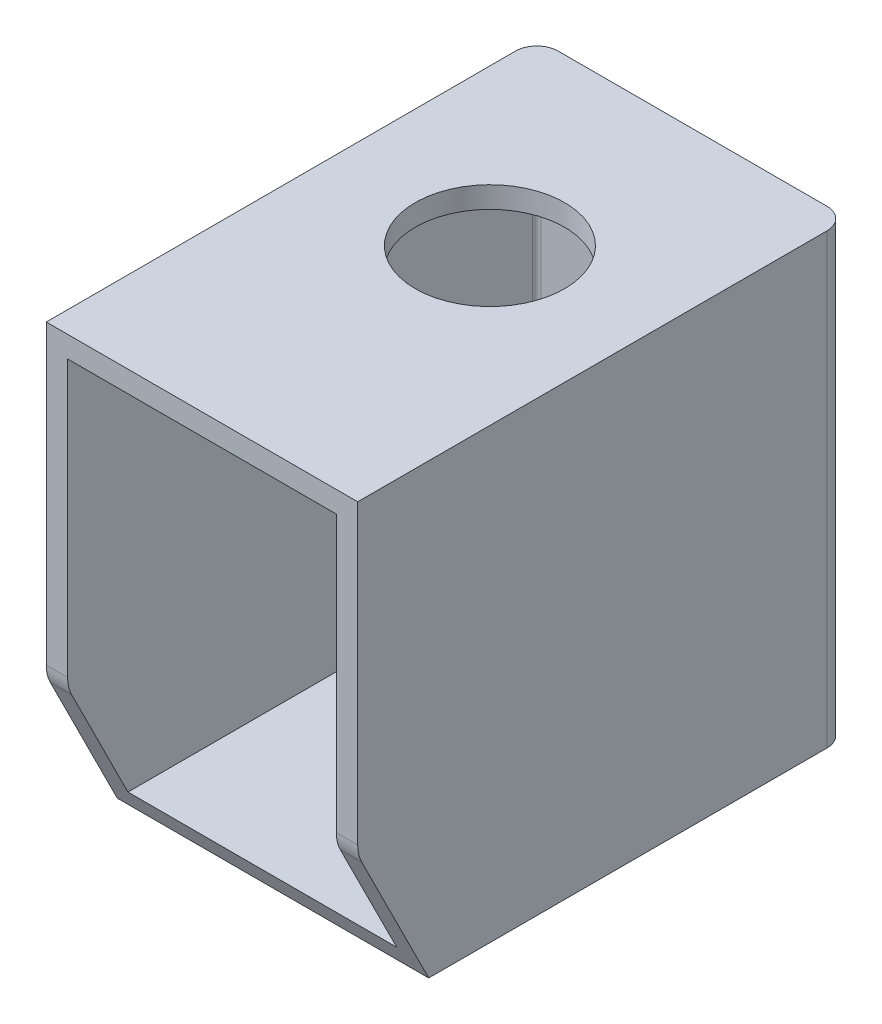
from build123d import *

# Parameters (mm, degrees)
MAINBODYS_W          = 14.6
MAINBODYS_H          = 23
MAIN_BODY_DEPTH      = 10.5
MB_FILLET_R          = 1
SHELL_START          = -6.3
SHELL_MB_OUTLINE_W   = 19
SHELL_MB_OUTLINE_H   = 22
SHELL_MB_DEPTH       = 12.6
TOP_BORE_REACH       = 27.031
TOPBORES_R           = 3.5
BOTTOMBORES_R        = 4.1
BOTTOM_BORE_DEPTH    = 25.197933796
ANGLEDCUT_DEPTH      = 18.19854645
ANGLEDCUT_DEPTH_BACK = 18.19854645
MB_INNER_FILLET_R    = 0.2
AC_F_R               = 1.76


# Read off the part's stored shape, not the designer's step: SHELL MB
with BuildPart() as part:
    # MainBodyS → MAIN BODY (new, symmetric)
    with BuildSketch(Plane(origin=(0, 0, 0), x_dir=(1, 0, 0), z_dir=(0, 1, 0))):
        Rectangle(MAINBODYS_W, MAINBODYS_H)
    extrude(amount=MAIN_BODY_DEPTH, both=True)

    # MB FILLET
    mb_fillet_edges = [part.edges().sort_by_distance(p)[0] for p in [
        (-7.3, 0, -11.5),
        (7.3, 0, -11.5),
    ]]
    fillet(mb_fillet_edges, radius=MB_FILLET_R)

    # SHELL MB outline → SHELL MB (cut)
    with BuildSketch(Plane.YZ.offset(SHELL_START)):
        with Locations((0, 0.5)):
            Rectangle(SHELL_MB_OUTLINE_W, SHELL_MB_OUTLINE_H)
    extrude(amount=SHELL_MB_DEPTH, mode=Mode.SUBTRACT)

    # TopBoreS → TOP BORE (cut, up to next)
    with BuildSketch(Plane(origin=(0, 10.5, 0), x_dir=(1, 0, 0), z_dir=(0, 1, 0)), mode=Mode.PRIVATE) as top_bore_sk1:
        with Locations(Location((0, 2, 0), (0, 0, 270))):
            Circle(TOPBORES_R)
    top_bore_tool1 = extrude(top_bore_sk1.sketch, amount=-TOP_BORE_REACH, mode=Mode.PRIVATE) & part.part
    add(top_bore_tool1.solids().sort_by_distance((0, 10.5, -2))[0], mode=Mode.SUBTRACT)

    # BottomBoreS → BOTTOM BORE (cut, through all)
    with BuildSketch(Plane(origin=(0, -9.5, 0), x_dir=(1, 0, 0), z_dir=(0, 1, 0))):
        with Locations(Location((0, 2, 0), (0, 0, 270))):
            Circle(BOTTOMBORES_R)
    extrude(amount=-BOTTOM_BORE_DEPTH, mode=Mode.SUBTRACT)

    # AngledCutS → AngledCut (cut, two sides: drawn at the far end of the back side and taken through both)
    with BuildSketch(Plane(origin=(0, 0, 0), x_dir=(0, 0, -1), z_dir=(1, 0, 0)).offset(-ANGLEDCUT_DEPTH_BACK)):
        Polygon((-41.74417665, 56.547529947), (-11.5, -3.85), (-8.17, -10.5), (22.07417665, -70.897529947), (-98.720883244, -131.385883248), (-162.539236545, -3.940823353), align=None)
    extrude(amount=ANGLEDCUT_DEPTH + ANGLEDCUT_DEPTH_BACK, mode=Mode.SUBTRACT)

    # MB INNER FILLET
    mb_inner_fillet_edges = [part.edges().sort_by_distance(p)[0] for p in [
        (6.3, 0, -10.5),
        (-6.3, 0, -10.5),
    ]]
    fillet(mb_inner_fillet_edges, radius=MB_INNER_FILLET_R)

    # AC F
    ac_f_edges = [part.edges().sort_by_distance(p)[0] for p in [
        (-6.8, -3.85, 11.5),
        (6.8, -3.85, 11.5),
    ]]
    fillet(ac_f_edges, radius=AC_F_R)


solid = part.part
